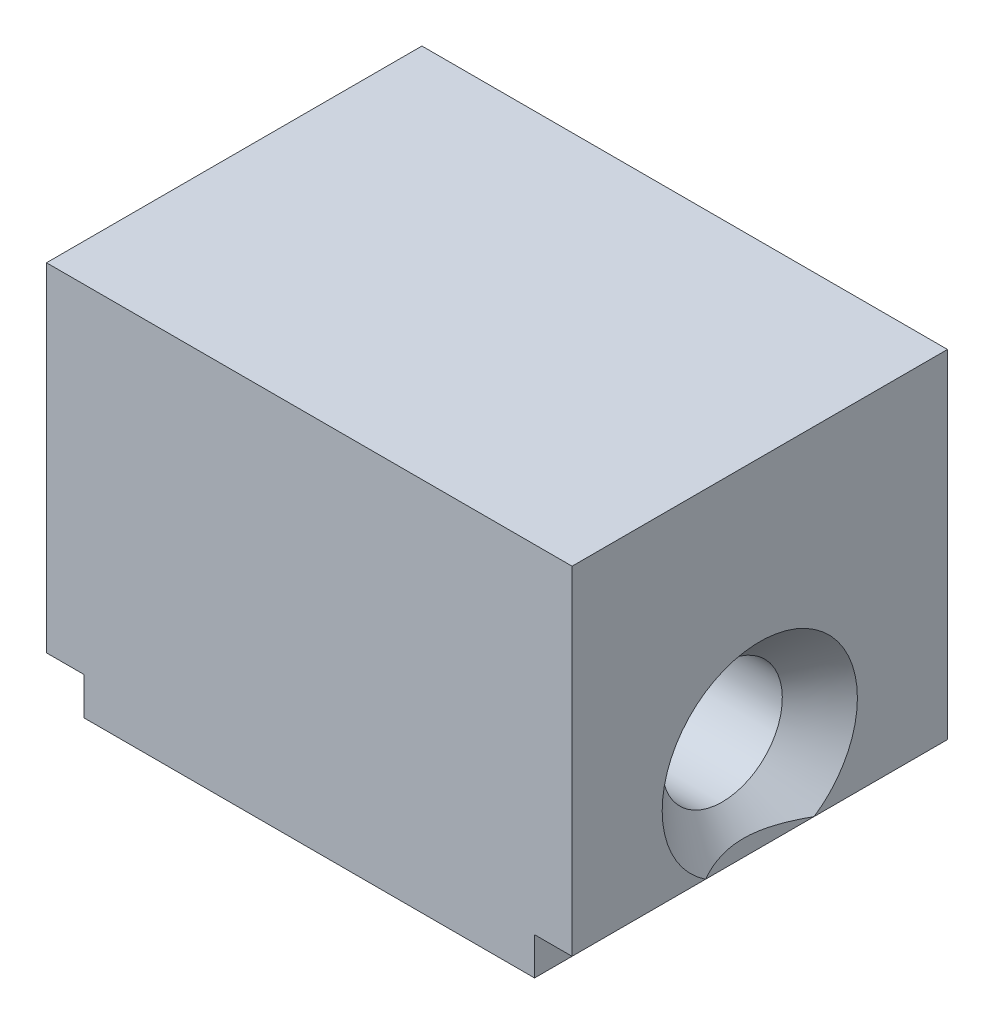
from build123d import *

# Parameters (mm, degrees)
SKETCH1_W           = 6
SKETCH1_H           = 5
BOSS_EXTRUDE1_DEPTH = 0.5
SKETCH2_W           = 7
SKETCH2_H           = 5
BOSS_EXTRUDE2_DEPTH = 4.5
SKETCH3_R           = 0.8
CUT_EXTRUDE1_DEPTH  = 9.958236434
CHAMFER1_SIZE       = 0.5


with BuildPart() as part:
    # Sketch1 → Boss-Extrude1 (new body)
    with BuildSketch(Plane(origin=(0, 0, 0), x_dir=(1, 0, 0), z_dir=(0, 1, 0))):
        Rectangle(SKETCH1_W, SKETCH1_H)
    extrude(amount=BOSS_EXTRUDE1_DEPTH)

    # Sketch2 → Boss-Extrude2 (add)
    with BuildSketch(Plane(origin=(0, 0.5, 0), x_dir=(1, 0, 0), z_dir=(0, 1, 0))):
        Rectangle(SKETCH2_W, SKETCH2_H)
    extrude(amount=BOSS_EXTRUDE2_DEPTH)

    # Sketch3 → Cut-Extrude1 (cut, through all)
    with BuildSketch(Plane.ZY.offset(3.5)):
        with Locations((0, 1.58)):
            Circle(SKETCH3_R)
    extrude(amount=-CUT_EXTRUDE1_DEPTH, mode=Mode.SUBTRACT)

    # Chamfer1
    # the kernel refuses this chamfer: 0.5 mm, written as the material it takes off along each edge
    with BuildSketch(Plane(origin=(3.5, 1.58, 0), x_dir=(0, 0, 1), z_dir=(0, -1, 0))) as chamfer1_piece_1:
        Polygon((0.8 + CHAMFER1_SIZE, 0), (0.8, CHAMFER1_SIZE), (0.8, 0), align=None)
    revolve(axis=Axis((3.5, 1.58, 0), (-1, 0, 0)), mode=Mode.SUBTRACT)
    with BuildSketch(Plane(origin=(-3.5, 1.58, 0), x_dir=(0, 0, 1), z_dir=(0, -1, 0))) as chamfer1_piece_2:
        Polygon((0.8 + CHAMFER1_SIZE, 0), (0.8, -CHAMFER1_SIZE), (0.8, 0), align=None)
    revolve(axis=Axis((-3.5, 1.58, 0), (-1, 0, 0)), mode=Mode.SUBTRACT)


solid = part.part
